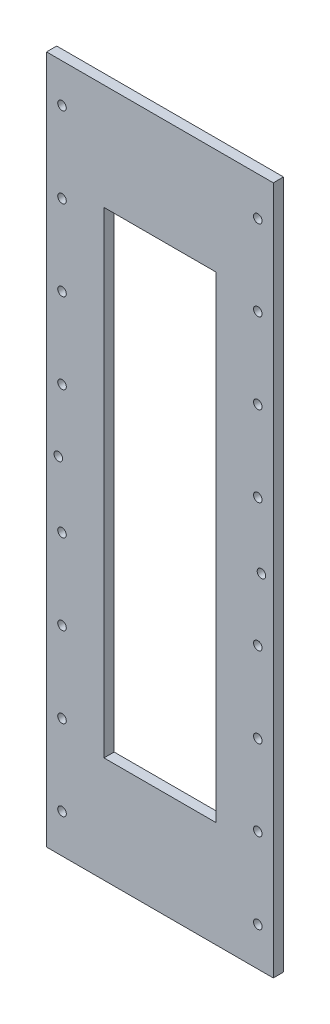
from build123d import *

# Parameters (mm, degrees)
BOSS_EXTRUDE1_DEPTH = 6
BOSS_EXTRUDE2_START = 6
SKETCH1_W           = 111.3
SKETCH1_H           = 338
SKETCH1_R           = 2.1
SKETCH1_W_2         = 54.9
SKETCH1_H_2         = 234
BOSS_EXTRUDE2_DEPTH = 5


with BuildPart() as part:
    # Sketch2 → Boss-Extrude1 (new body)
    with BuildSketch(Plane.XY.offset(0.1)):
        with BuildLine():
            ThreePointArc((-47.25, -13.21070024), (-46.819703068, -14.892045855), (-45.634615385, -16.159975549))
            ThreePointArc((-45.634615385, -16.159975549), (-42.679763233, -19.15303821), (-41.306728934, -23.128507005))
            ThreePointArc((-41.306728934, -23.128507005), (-44.357328362, -26.821736965), (-45.45, -31.485659466))
            Line((-45.45, -31.485659466), (-45.45, -150))
            ThreePointArc((-45.45, -150), (-42.374621202, -157.424621202), (-34.95, -160.5))
            Line((-34.95, -160.5), (34.95, -160.5))
            ThreePointArc((34.95, -160.5), (42.374621202, -157.424621202), (45.45, -150))
            Line((45.45, -150), (45.45, -31.485659466))
            ThreePointArc((45.45, -31.485659466), (44.357328362, -26.821736965), (41.306728934, -23.128507005))
            ThreePointArc((41.306728934, -23.128507005), (42.679763233, -19.15303821), (45.634615385, -16.159975549))
            ThreePointArc((45.634615385, -16.159975549), (46.819703068, -14.892045855), (47.25, -13.21070024))
            Line((47.25, -13.21070024), (47.25, 13.21070024))
            ThreePointArc((47.25, 13.21070024), (46.819703068, 14.892045855), (45.634615385, 16.159975549))
            ThreePointArc((45.634615385, 16.159975549), (42.679763233, 19.15303821), (41.306728934, 23.128507005))
            ThreePointArc((41.306728934, 23.128507005), (44.357328362, 26.821736965), (45.45, 31.485659466))
            Line((45.45, 31.485659466), (45.45, 150))
            ThreePointArc((45.45, 150), (42.374621202, 157.424621202), (34.95, 160.5))
            Line((34.95, 160.5), (-34.95, 160.5))
            ThreePointArc((-34.95, 160.5), (-42.374621202, 157.424621202), (-45.45, 150))
            Line((-45.45, 150), (-45.45, 31.485659466))
            ThreePointArc((-45.45, 31.485659466), (-44.357328362, 26.821736965), (-41.306728934, 23.128507005))
            ThreePointArc((-41.306728934, 23.128507005), (-42.679763233, 19.15303821), (-45.634615385, 16.159975549))
            ThreePointArc((-45.634615385, 16.159975549), (-46.819703068, 14.892045855), (-47.25, 13.21070024))
            Line((-47.25, 13.21070024), (-47.25, -13.21070024))
        make_face()
        with BuildLine():
            ThreePointArc((-40.45, 31.485659466), (-39.318743113, 28.144389705), (-36.390333232, 26.177605191))
            ThreePointArc((-36.390333232, 26.177605191), (-37.409307611, 18.483960794), (-42.25, 12.417811265))
            Line((-42.25, 12.417811265), (-42.25, -12.417811265))
            ThreePointArc((-42.25, -12.417811265), (-37.409307611, -18.483960794), (-36.390333232, -26.177605191))
            ThreePointArc((-36.390333232, -26.177605191), (-39.318743113, -28.144389705), (-40.45, -31.485659466))
            Line((-40.45, -31.485659466), (-40.45, -150))
            ThreePointArc((-40.45, -150), (-38.839087297, -153.889087297), (-34.95, -155.5))
            Line((-34.95, -155.5), (34.95, -155.5))
            ThreePointArc((34.95, -155.5), (38.839087297, -153.889087297), (40.45, -150))
            Line((40.45, -150), (40.45, -31.485659466))
            ThreePointArc((40.45, -31.485659466), (39.318743113, -28.144389705), (36.390333232, -26.177605191))
            ThreePointArc((36.390333232, -26.177605191), (37.409307611, -18.483960794), (42.25, -12.417811265))
            Line((42.25, -12.417811265), (42.25, 12.417811265))
            ThreePointArc((42.25, 12.417811265), (37.409307611, 18.483960794), (36.390333232, 26.177605191))
            ThreePointArc((36.390333232, 26.177605191), (39.318743113, 28.144389705), (40.45, 31.485659466))
            Line((40.45, 31.485659466), (40.45, 150))
            ThreePointArc((40.45, 150), (38.839087297, 153.889087297), (34.95, 155.5))
            Line((34.95, 155.5), (-34.95, 155.5))
            ThreePointArc((-34.95, 155.5), (-38.839087297, 153.889087297), (-40.45, 150))
            Line((-40.45, 150), (-40.45, 31.485659466))
        make_face(mode=Mode.SUBTRACT)
    extrude(amount=BOSS_EXTRUDE1_DEPTH)

    # Sketch1 → Boss-Extrude2 (add)
    with BuildSketch(Plane.XY.offset(0.1).offset(BOSS_EXTRUDE2_START)):
        Rectangle(SKETCH1_W, SKETCH1_H)
        with Locations(Location((49.85, 0, 0), (0, 0, 180))):
            Circle(SKETCH1_R, mode=Mode.SUBTRACT)
        with Locations(Location((48.05, -70.990439644, 0), (0, 0, 180))):
            Circle(SKETCH1_R, mode=Mode.SUBTRACT)
        with Locations(Location((48.05, -110.495219822, 0), (0, 0, 180))):
            Circle(SKETCH1_R, mode=Mode.SUBTRACT)
        with Locations(Location((48.05, -150, 0), (0, 0, 180))):
            Circle(SKETCH1_R, mode=Mode.SUBTRACT)
        with Locations(Location((-48.05, -150, 0), (0, 0, 180))):
            Circle(SKETCH1_R, mode=Mode.SUBTRACT)
        with Locations(Location((-48.05, -110.495219822, 0), (0, 0, 180))):
            Circle(SKETCH1_R, mode=Mode.SUBTRACT)
        with Locations(Location((-48.05, -70.990439644, 0), (0, 0, 180))):
            Circle(SKETCH1_R, mode=Mode.SUBTRACT)
        with Locations(Location((-48.05, 150, 0), (0, 0, 180))):
            Circle(SKETCH1_R, mode=Mode.SUBTRACT)
        with Locations(Location((48.05, 150, 0), (0, 0, 180))):
            Circle(SKETCH1_R, mode=Mode.SUBTRACT)
        with Locations(Location((48.05, 110.495219822, 0), (0, 0, 180))):
            Circle(SKETCH1_R, mode=Mode.SUBTRACT)
        with Locations(Location((-48.05, 110.495219822, 0), (0, 0, 180))):
            Circle(SKETCH1_R, mode=Mode.SUBTRACT)
        with Locations(Location((-48.05, 70.990439644, 0), (0, 0, 180))):
            Circle(SKETCH1_R, mode=Mode.SUBTRACT)
        with Locations(Location((-48.05, 31.485659466, 0), (0, 0, 180))):
            Circle(SKETCH1_R, mode=Mode.SUBTRACT)
        with Locations(Location((48.05, 70.990439644, 0), (0, 0, 180))):
            Circle(SKETCH1_R, mode=Mode.SUBTRACT)
        with Locations(Location((48.05, 31.485659466, 0), (0, 0, 180))):
            Circle(SKETCH1_R, mode=Mode.SUBTRACT)
        with Locations(Location((-49.85, 0, 0), (0, 0, 180))):
            Circle(SKETCH1_R, mode=Mode.SUBTRACT)
        with Locations(Location((-48.05, -31.485659466, 0), (0, 0, 180))):
            Circle(SKETCH1_R, mode=Mode.SUBTRACT)
        with Locations(Location((48.05, -31.485659466, 0), (0, 0, 180))):
            Circle(SKETCH1_R, mode=Mode.SUBTRACT)
        Rectangle(SKETCH1_W_2, SKETCH1_H_2, mode=Mode.SUBTRACT)
    extrude(amount=BOSS_EXTRUDE2_DEPTH)


solid = part.part
